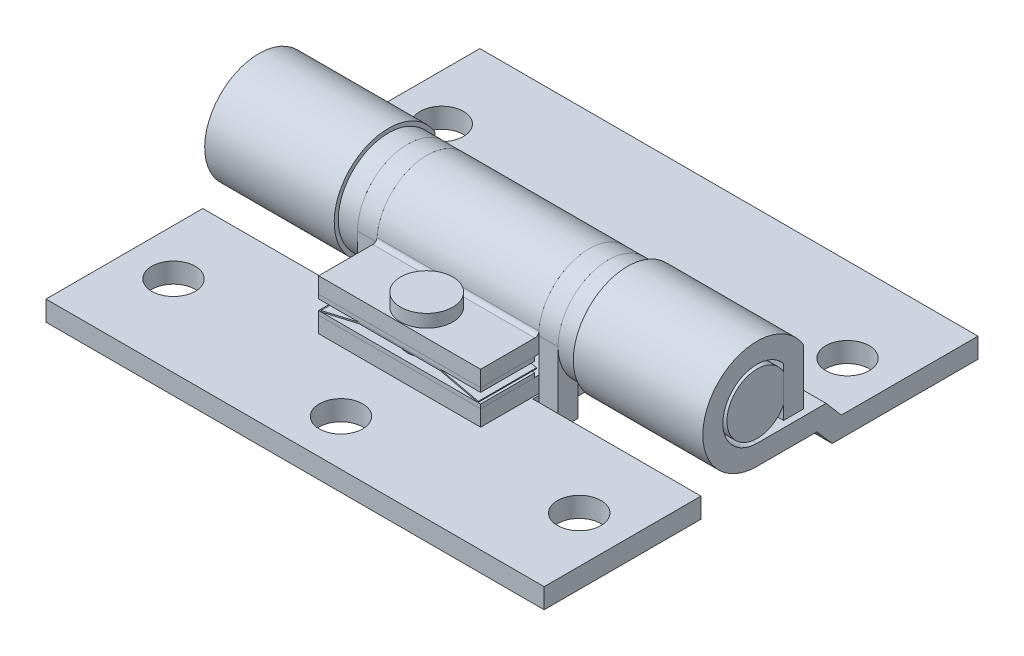
from build123d import *

# Parameters (mm, degrees)
EXTRUDE1_DEPTH                      = 24.60625
CUT_EXTRUDE1_DEPTH                  = 34.652862049
CUT_EXTRUDE1_DEPTH_BACK             = 34.652862049
SKETCH2_W                           = 23.622
SKETCH2_H                           = 13.6859375
EXTRUDE2_START                      = -24.60625
EXTRUDE2_DEPTH                      = 49.2125
SKETCH16_W                          = 16.60525
SKETCH16_H                          = 10.143603833
CUT_EXTRUDE4_DEPTH                  = 35.524564766
EXTRUDE7_DEPTH                      = 1.905
SKETCH18_R                          = 4.9577625
SKETCH18_R_2                        = 2.9765625
EXTRUDE8_DEPTH                      = 1.905
EXTRUDE9_START                      = -8.001
EXTRUDE9_DEPTH                      = 16.002
EXTRUDE10_START                     = -8.001
SKETCH21_W                          = 5.347229167
SKETCH21_H                          = 0.40005
EXTRUDE10_DEPTH                     = 16.002
EXTRUDE12_REACH                     = 35.653
SKETCH24_W                          = 5.347229167
SKETCH24_H                          = 0.40005
EXTRUDE12_DIRECTION_2_REACH         = 35.653
EXTRUDE11_DEPTH                     = 5.747279167
EXTRUDE5_START                      = -24.60625
EXTRUDE5_DEPTH                      = 49.2125
SKETCH11_W                          = 2.1463
SKETCH11_H                          = 1.9812
F_8_0_199_DIAMETER_HOLE3_AT_2_COUNT = 2
F_8_0_199_DIAMETER_HOLE3_AT_2_PITCH = 40.084375
F_8_0_199_DIAMETER_HOLE3_AT_3_COUNT = 2
F_8_0_199_DIAMETER_HOLE3_AT_3_PITCH = 26.5
F_8_0_199_DIAMETER_HOLE3_AT_4_COUNT = 2
F_8_0_199_DIAMETER_HOLE3_AT_4_PITCH = 48.052129184
F_8_0_199_DIAMETER_HOLE3_AT_5_COUNT = 2
F_8_0_199_DIAMETER_HOLE3_AT_5_PITCH = 36.078931245
CUT_EXTRUDE3_START                  = -4.957763
SKETCH14_R                          = 1.913863542
CUT_EXTRUDE3_DEPTH                  = 4.957763


# Read off the part's stored shape, not the designer's step: Extrude9
with BuildPart() as part:
    # Sketch1 → Extrude1 (new, symmetric)
    with BuildSketch(Plane(origin=(0, 0, 0), x_dir=(0, 0, -1), z_dir=(1, 0, 0))):
        with BuildLine():
            Line((21.828125, -5.1308), (8.328125, -5.1308))
            Line((8.328125, -5.1308), (6.822070985, -3.3766125))
            Line((6.822070985, -3.3766125), (0, -3.3766125))
            ThreePointArc((0, -3.3766125), (-3.048395485, 1.452169736), (2.622028833, 2.127551827))
            Line((2.622028833, 2.127551827), (2.622028833, -2.7416125))
            Line((2.622028833, -2.7416125), (4.603228833, -2.7416125))
            Line((4.603228833, -2.7416125), (4.603228833, 2.7416125))
            ThreePointArc((4.603228833, 2.7416125), (-4.658068296, 2.647367472), (0, -5.3578125))
            Line((0, -5.3578125), (5.911819151, -5.3578125))
            Line((5.911819151, -5.3578125), (7.417873166, -7.112))
            Line((7.417873166, -7.112), (21.828125, -7.112))
            Line((21.828125, -7.112), (21.828125, -5.1308))
        make_face()
    extrude(amount=EXTRUDE1_DEPTH, both=True)

    # Sketch2 → Cut-Extrude1 (cut, two sides: drawn at the far end of the back side and taken through both)
    with BuildSketch(Plane(origin=(0, 0, 0), x_dir=(1, 0, 0), z_dir=(0, 1, 0)).offset(-CUT_EXTRUDE1_DEPTH_BACK)):
        with Locations((0, 1.48515625)):
            Rectangle(SKETCH2_W, SKETCH2_H)
    extrude(amount=CUT_EXTRUDE1_DEPTH + CUT_EXTRUDE1_DEPTH_BACK, mode=Mode.SUBTRACT)

    # Sketch11 → #8 (0.199) Diameter Hole3 (revolve, cut)
    with BuildSketch(Plane(origin=(-20.0421875, -5.1308, -13.5), x_dir=(0, 0, 1), z_dir=(1, 0, 0))):
        with Locations((1.07315, 0.9906)):
            Rectangle(SKETCH11_W, SKETCH11_H)
    f_8_0_199_diameter_hole3 = revolve(axis=Axis((-20.0421875, 1.2192, -13.5), (0, -1, 0)), mode=Mode.SUBTRACT)

    # #8 (0.199) Diameter Hole3 at 2: #8 (0.199) Diameter Hole3 ×2
    with Locations(*[(i * F_8_0_199_DIAMETER_HOLE3_AT_2_PITCH, 0, 0) for i in range(1, F_8_0_199_DIAMETER_HOLE3_AT_2_COUNT)]):
        add(f_8_0_199_diameter_hole3, mode=Mode.SUBTRACT)


with BuildPart() as body_2:
    # Sketch3 → Extrude2 (new body)
    with BuildSketch(Plane(origin=(0, 0, 0), x_dir=(0, 0, -1), z_dir=(1, 0, 0)).offset(EXTRUDE2_START)):
        Polygon((-21.034375, -7.112), (-5.540375, -7.112), (4.603228833, -7.112), (4.603228833, -5.1308), (-5.540375, -5.1308), (-21.034375, -5.1308), align=None)
    extrude(amount=EXTRUDE2_DEPTH)

    # Sketch16 → Cut-Extrude4 (cut, through all)
    with BuildSketch(Plane(origin=(0, -5.1308, 0), x_dir=(-1, 0, 0), z_dir=(0, 1, 0))):
        with Locations((-16.303625, 0.468573083)):
            Rectangle(SKETCH16_W, SKETCH16_H)
        with Locations((16.303625, 0.468573083)):
            Rectangle(SKETCH16_W, SKETCH16_H)
    extrude(amount=-CUT_EXTRUDE4_DEPTH, mode=Mode.SUBTRACT)

    # Sketch17 → Extrude7 (add)
    with BuildSketch(Plane(origin=(8.001, 0, 0), x_dir=(0, 0, -1), z_dir=(1, 0, 0))):
        with BuildLine():
            Line((2.9765625, -7.112), (2.9765625, 0))
            ThreePointArc((2.9765625, 0), (0, 2.9765625), (-2.9765625, 0))
            Line((-2.9765625, 0), (-2.9765625, -7.112))
            Line((-2.9765625, -7.112), (-4.9577625, -7.112))
            Line((-4.9577625, -7.112), (-4.9577625, 0))
            ThreePointArc((-4.9577625, 0), (0, 4.9577625), (4.9577625, 0))
            Line((4.9577625, 0), (4.9577625, -7.112))
            Line((4.9577625, -7.112), (2.9765625, -7.112))
        make_face()
    extrude7 = extrude(amount=EXTRUDE7_DEPTH)

    # Mirror3: Extrude7 across plane
    add(extrude7.mirror(Plane(origin=(0, 0, 0), x_dir=(0, 0, 1), z_dir=(1, 0, 0))))

    # #8 (0.199) Diameter Hole3 at 3: #8 (0.199) Diameter Hole3 ×2
    with Locations(*[(0, 0, i * F_8_0_199_DIAMETER_HOLE3_AT_3_PITCH) for i in range(1, F_8_0_199_DIAMETER_HOLE3_AT_3_COUNT)]):
        add(f_8_0_199_diameter_hole3, mode=Mode.SUBTRACT)

    # #8 (0.199) Diameter Hole3 at 4: #8 (0.199) Diameter Hole3 ×2
    with Locations(*[Vector(0.8341852001249447, 0, 0.5514844076603672) * (i * F_8_0_199_DIAMETER_HOLE3_AT_4_PITCH) for i in range(1, F_8_0_199_DIAMETER_HOLE3_AT_4_COUNT)]):
        add(f_8_0_199_diameter_hole3, mode=Mode.SUBTRACT)

    # #8 (0.199) Diameter Hole3 at 5: #8 (0.199) Diameter Hole3 ×2
    with Locations(*[Vector(0.5555094568592278, 0, 0.8315102184218579) * (i * F_8_0_199_DIAMETER_HOLE3_AT_5_PITCH) for i in range(1, F_8_0_199_DIAMETER_HOLE3_AT_5_COUNT)]):
        add(f_8_0_199_diameter_hole3, mode=Mode.SUBTRACT)


with BuildPart() as body_3:
    # Sketch18 → Extrude8 (new body)
    with BuildSketch(Plane.ZY.offset(-11.811)):
        Circle(SKETCH18_R)
        Circle(SKETCH18_R_2, mode=Mode.SUBTRACT)
    extrude(amount=EXTRUDE8_DEPTH)


with BuildPart() as body_4:
    # Mirror4: mirrored copy
    add(body_3.part.mirror(Plane(origin=(0, 0, 0), x_dir=(0, 0, 1), z_dir=(1, 0, 0))))


with BuildPart() as body_5:
    # Extrude9 outline → Extrude9 (new body)
    with BuildSketch(Plane(origin=(0, 0, 0), x_dir=(0, 0, -1), z_dir=(1, 0, 0)).offset(EXTRUDE9_START)):
        with BuildLine():
            Line((-10.705041667, -3.3766125), (-10.705041667, -4.9577625))
            Line((-10.705041667, -4.9577625), (0, -4.9577625))
            ThreePointArc((0, -4.9577625), (3.638885972, 3.367182486), (-4.942872157, 0.383958131))
            ThreePointArc((-4.942872157, 0.383958131), (-5.075146914, 0.110716009), (-5.3578125, 0))
            Line((-5.3578125, 0), (-10.705041667, 0))
            Line((-10.705041667, 0), (-10.705041667, -1.58115))
            Line((-10.705041667, -1.58115), (-5.3578125, -1.58115))
            ThreePointArc((-5.3578125, -1.58115), (-4.001271232, -1.049812466), (-3.366471046, 0.261504625))
            ThreePointArc((-3.366471046, 0.261504625), (2.478357497, 2.293306803), (0, -3.3766125))
            Line((0, -3.3766125), (-10.705041667, -3.3766125))
        make_face()
    extrude(amount=EXTRUDE9_DEPTH)


with BuildPart() as body_6:
    # Sketch21 → Extrude10 (new body)
    with BuildSketch(Plane(origin=(0, 0, 0), x_dir=(0, 0, -1), z_dir=(1, 0, 0)).offset(EXTRUDE10_START)):
        with Locations((-8.031427084, -3.1765875)):
            Rectangle(SKETCH21_W, SKETCH21_H)
    extrude(amount=EXTRUDE10_DEPTH)


with BuildPart() as body_7:

    # Extrude12: up to this face of the body (flat: up to its plane)
    extrude12_end = Plane(body_5.part.faces().sort_by_distance((8.001, -3.561988084, 5.352520833))[0])
    # Sketch24 → Extrude12 (new, up to the picked face)
    with BuildSketch(Plane(origin=(0, 0, 0), x_dir=(0, 0, -1), z_dir=(1, 0, 0)), mode=Mode.PRIVATE) as extrude12_sk1:
        with Locations((-8.031427084, -1.781175)):
            Rectangle(SKETCH24_W, SKETCH24_H)
    extrude12_tool1 = split(extrude(extrude12_sk1.sketch, amount=EXTRUDE12_REACH, mode=Mode.PRIVATE), bisect_by=extrude12_end, keep=Keep.BOTH, mode=Mode.PRIVATE)
    add(extrude12_tool1.solids().sort_by(Axis((0, -1.781175, 8.031427), (1, 0, 0)))[0])


    # Extrude12 direction 2: up to this face of the body (flat: up to its plane)
    extrude12_direction_2_end = Plane(body_5.part.faces().sort_by_distance((-8.001, -3.561988084, 5.352520833))[0])
    # Sketch24 → Extrude12 direction 2 (add, up to the picked face)
    with BuildSketch(Plane(origin=(0, 0, 0), x_dir=(0, 0, -1), z_dir=(1, 0, 0)), mode=Mode.PRIVATE) as extrude12_direction_2_sk1:
        with Locations((-8.031427084, -1.781175)):
            Rectangle(SKETCH24_W, SKETCH24_H)
    extrude12_direction_2_tool1 = split(extrude(extrude12_direction_2_sk1.sketch, amount=-EXTRUDE12_DIRECTION_2_REACH, mode=Mode.PRIVATE), bisect_by=extrude12_direction_2_end, keep=Keep.BOTH, mode=Mode.PRIVATE)
    add(extrude12_direction_2_tool1.solids().sort_by(Axis((0, -1.781175, 8.031427), (-1, 0, 0)))[0])


with BuildPart() as body_8:
    # Sketch22 → Extrude11 (new body)
    with BuildSketch(Plane.XY.offset(10.705041667)):
        Polygon((7.747, -2.9765625), (3.986530586, -2.1082), (-3.986530586, -2.1082), (-7.747, -2.9765625), (-7.775549223, -2.85292925), (-4.0005, -1.9812), (4.0005, -1.9812), (7.775549223, -2.85292925), align=None)
    extrude(amount=-EXTRUDE11_DEPTH)


with BuildPart() as body_9:
    # Sketch6 → Extrude5 (new body)
    with BuildSketch(Plane(origin=(0, 0, 0), x_dir=(0, 0, -1), z_dir=(1, 0, 0)).offset(EXTRUDE5_START)):
        with BuildLine():
            Line((2.622028833, 1.408860929), (2.622028833, -1.408860929))
            ThreePointArc((2.622028833, -1.408860929), (-2.9765625, 0), (2.622028833, 1.408860929))
        make_face()
    extrude(amount=EXTRUDE5_DEPTH)


with BuildPart() as cut_extrude3_tool:
    # Sketch14 → Cut-Extrude3 (new body)
    with BuildSketch(Plane(origin=(0, 0, 0), x_dir=(-1, 0, 0), z_dir=(0, 1, 0)).offset(CUT_EXTRUDE3_START)):
        with Locations(Location((0, 8.031427083, 0), (0, 0, 90))):
            Circle(SKETCH14_R)
    extrude(amount=CUT_EXTRUDE3_DEPTH)


with BuildPart() as body_5_1:
    add(body_5.part)

    # Cut-Extrude3: cut by cut_extrude3_tool
    add(cut_extrude3_tool.part, mode=Mode.SUBTRACT)


with BuildPart() as body_6_1:
    add(body_6.part)

    # Cut-Extrude3: cut by cut_extrude3_tool
    add(cut_extrude3_tool.part, mode=Mode.SUBTRACT)


with BuildPart() as body_8_1:
    add(body_8.part)

    # Cut-Extrude3: cut by cut_extrude3_tool
    add(cut_extrude3_tool.part, mode=Mode.SUBTRACT)


with BuildPart() as body_10:
    # Sketch23 → Revolve2 (revolve)
    with BuildSketch(Plane(origin=(0, 0, 0), x_dir=(0, 0, -1), z_dir=(1, 0, 0)), mode=Mode.PRIVATE) as revolve2_sk:
        Polygon((-8.031427083, 1.27), (-8.031427083, -5.1308), (-6.117563542, -5.1308), (-6.117563542, 0), (-5.44909375, 0), (-5.44909375, 1.27), align=None)
    revolve(revolve2_sk.sketch.rotate(Axis((0, 1.27, 8.031427083), (0, -1, 0)), 180), axis=Axis((0, 1.27, 8.031427083), (0, -1, 0)))


solid = Compound([part.part, body_2.part, body_3.part, body_4.part, body_7.part, body_9.part, body_5_1.part, body_6_1.part, body_8_1.part, body_10.part])
